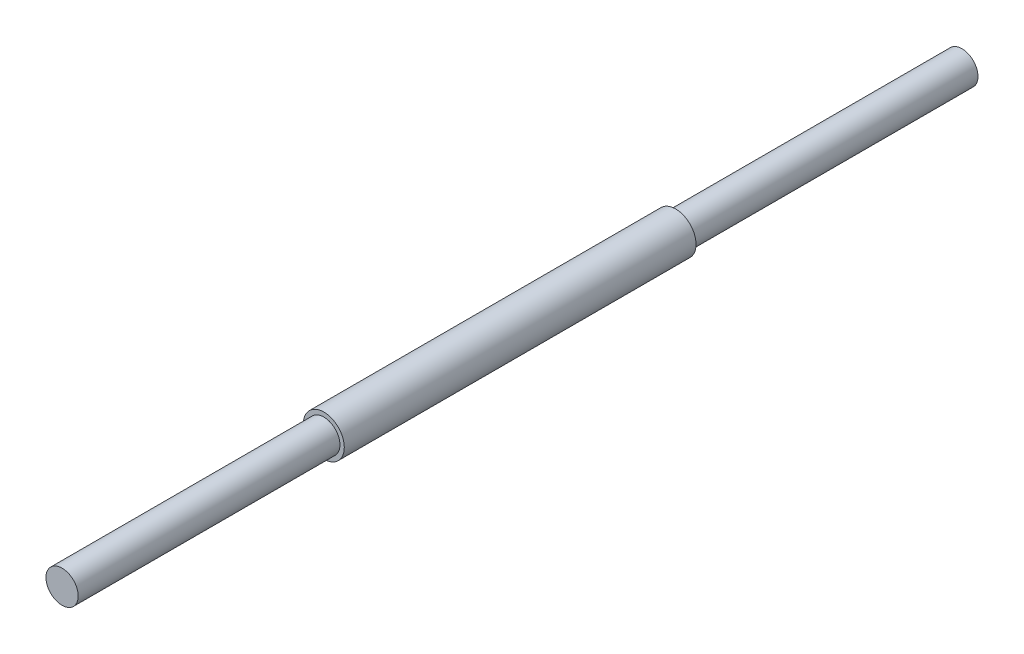
from build123d import *

# Parameters (mm, degrees)
BOSS_EXTRUDE1_DEPTH      = 69.85
BOSS_EXTRUDE1_DEPTH_BACK = 69.85
SKETCH2_R                = 2.5
BOSS_EXTRUDE2_DEPTH      = 29.21
BOSS_EXTRUDE2_DEPTH_BACK = 25.4
SKETCH3_R                = 3.175


with BuildPart() as part:
    # Sketch2 → Boss-Extrude1 (new, two sides: drawn at the far end of the back side and taken through both)
    with BuildSketch(Plane.XY.offset(-BOSS_EXTRUDE1_DEPTH_BACK)):
        Circle(SKETCH2_R)
    extrude(amount=BOSS_EXTRUDE1_DEPTH + BOSS_EXTRUDE1_DEPTH_BACK)

    # Sketch3 → Boss-Extrude2 (add, two sides: drawn at the far end of the back side and taken through both)
    with BuildSketch(Plane.XY.offset(-BOSS_EXTRUDE2_DEPTH_BACK)):
        Circle(SKETCH3_R)
    extrude(amount=BOSS_EXTRUDE2_DEPTH + BOSS_EXTRUDE2_DEPTH_BACK)


solid = part.part
